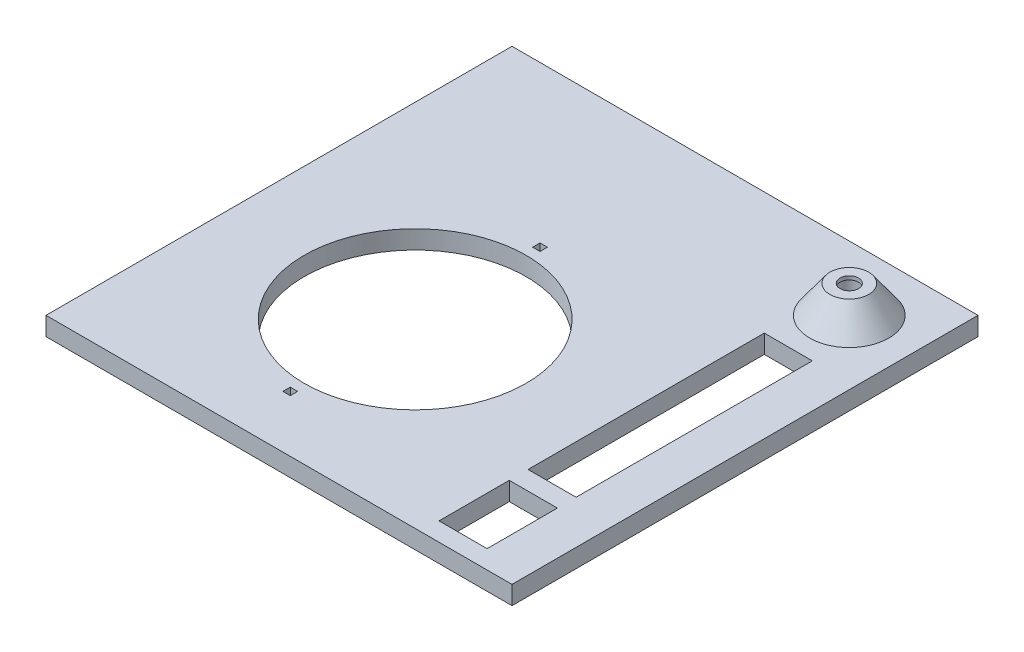
from build123d import *

# Parameters (mm, degrees)
SKETCH1_W           = 126
SKETCH1_H           = 126
BOSS_EXTRUDE1_DEPTH = 5
SKETCH3_R           = 12.5
BOSS_EXTRUDE2_DEPTH = 7.5
SKETCH4_R           = 2.95
CUT_EXTRUDE1_DEPTH  = 11.5
SKETCH6_R           = 2.5
CUT_EXTRUDE2_DEPTH  = 179.628805068
CHAMFER1_SIZE       = 10
CHAMFER1_SIZE_2     = 7.26542528
SKETCH8_W           = 13
SKETCH8_H           = 63.879672954
SKETCH8_H_2         = 19
CUT_EXTRUDE3_DEPTH  = 179.348675353
SKETCH9_R           = 30
CUT_EXTRUDE4_DEPTH  = 179.348675353
SKETCH11_W          = 2
SKETCH11_H          = 2
CUT_EXTRUDE5_DEPTH  = 3


with BuildPart() as part:
    # Sketch1 → Boss-Extrude1 (new body)
    with BuildSketch(Plane(origin=(0, 0, 0), x_dir=(1, 0, 0), z_dir=(0, 1, 0))):
        with Locations((63, 63)):
            Rectangle(SKETCH1_W, SKETCH1_H)
    extrude(amount=BOSS_EXTRUDE1_DEPTH)

    # Sketch3 → Boss-Extrude2 (add)
    with BuildSketch(Plane(origin=(0, 5, 0), x_dir=(1, 0, 0), z_dir=(0, 1, 0))):
        with Locations(Location((108.6, 108.6, 0), (0, 0, 90))):
            Circle(SKETCH3_R)
    extrude(amount=BOSS_EXTRUDE2_DEPTH)

    # Sketch4 → Cut-Extrude1 (cut)
    with BuildSketch(Plane.XZ):
        with Locations(Location((108.6, -108.6, 0), (0, 0, 270))):
            Circle(SKETCH4_R)
    extrude(amount=-CUT_EXTRUDE1_DEPTH, mode=Mode.SUBTRACT)

    # Sketch6 → Cut-Extrude2 (cut, through all)
    with BuildSketch(Plane(origin=(0, 12.5, 0), x_dir=(1, 0, 0), z_dir=(0, 1, 0))):
        with Locations(Location((108.6, 108.6, 0), (0, 0, 270))):
            Circle(SKETCH6_R)
    extrude(amount=-CUT_EXTRUDE2_DEPTH, mode=Mode.SUBTRACT)

    # Chamfer1
    # the kernel refuses this chamfer: 10, 7.26542528 mm, written as the material it takes off along each edge
    with BuildSketch(Plane(origin=(108.6, 12.5, -108.6), x_dir=(0, 0, -1), z_dir=(1, 0, 0))) as chamfer1_piece_1_section:
        Polygon((12.5, -CHAMFER1_SIZE), (12.5 - CHAMFER1_SIZE_2, 0), (12.5, 0), align=None)
    chamfer1_piece_1 = revolve(axis=Axis((108.6, 12.5, -108.6), (0, 1, 0)), mode=Mode.PRIVATE)
    chamfer1_piece_1 = split(chamfer1_piece_1, bisect_by=Plane(origin=(108.6, 5, -100.650989912), z_dir=(0, 1, 0)), keep=Keep.TOP, mode=Mode.PRIVATE)
    add(chamfer1_piece_1, mode=Mode.SUBTRACT)

    # Sketch8 → Cut-Extrude3 (cut, through all)
    with BuildSketch(Plane(origin=(0, 5, 0), x_dir=(1, 0, 0), z_dir=(0, 1, 0))):
        with Locations((107.763328316, 61.0093315)):
            Rectangle(SKETCH8_W, SKETCH8_H)
        with Locations((107.763328316, 14.5)):
            Rectangle(SKETCH8_W, SKETCH8_H_2)
    extrude(amount=-CUT_EXTRUDE3_DEPTH, mode=Mode.SUBTRACT)

    # Sketch9 → Cut-Extrude4 (cut, through all)
    with BuildSketch(Plane(origin=(0, 5, 0), x_dir=(1, 0, 0), z_dir=(0, 1, 0))):
        with Locations(Location((50.837155032, 48.974583989, 0), (0, 0, 270))):
            Circle(SKETCH9_R)
    extrude(amount=-CUT_EXTRUDE4_DEPTH, mode=Mode.SUBTRACT)

    # Sketch11 → Cut-Extrude5 (cut)
    with BuildSketch(Plane(origin=(0, 5, 0), x_dir=(1, 0, 0), z_dir=(0, 1, 0))):
        with Locations((50.837155032, 82.738467737)):
            Rectangle(SKETCH11_W, SKETCH11_H)
        with Locations((50.837155032, 15.21070024)):
            Rectangle(SKETCH11_W, SKETCH11_H)
    extrude(amount=-CUT_EXTRUDE5_DEPTH, mode=Mode.SUBTRACT)


solid = part.part
